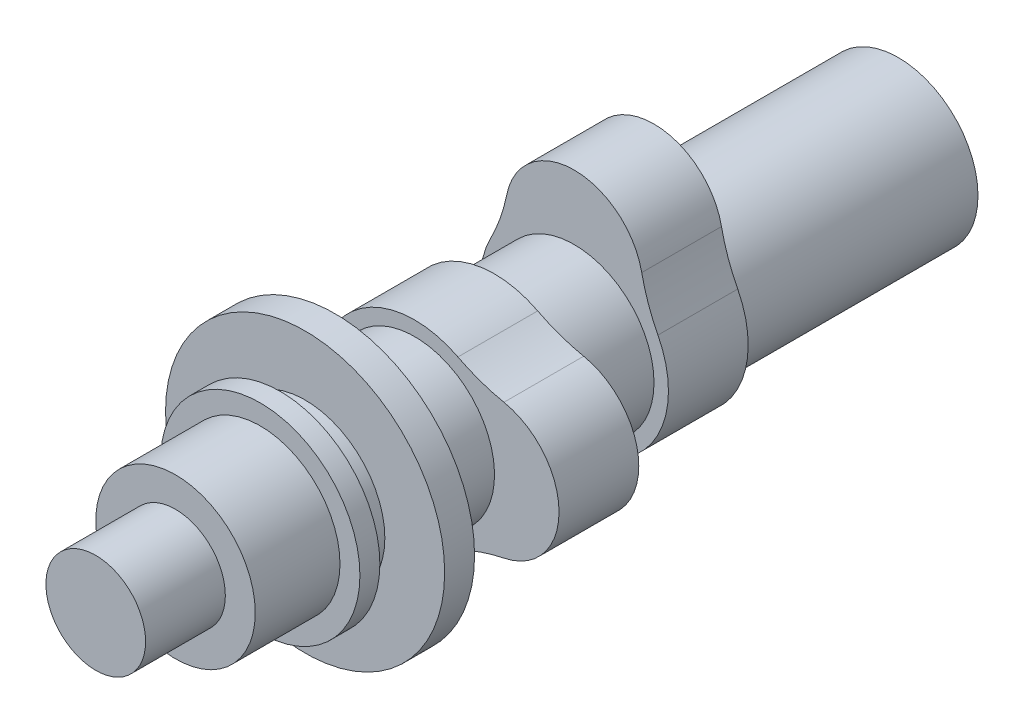
from build123d import *

# Parameters (mm, degrees)
BOSS_EXTRUDE2_DEPTH      = 12.7
BOSS_EXTRUDE3_DEPTH      = 63.5
BOSS_EXTRUDE3_DEPTH_BACK = 51.59375
SKETCH3_R                = 12.7
CRVPATTERN3_START        = 25.4
CRVPATTERN3_OUTLINE_R    = 12.7
CRVPATTERN3_DEPTH        = 12.7
BOSS_EXTRUDE5_START      = -25.4
SKETCH7_R                = 22.225
BOSS_EXTRUDE5_DEPTH      = 4.7625
BOSS_EXTRUDE7_START      = -13.49375
SKETCH10_R               = 15.875
BOSS_EXTRUDE7_DEPTH      = 3.175
SKETCH9_R                = 7.9375
BOSS_EXTRUDE8_DEPTH      = 12.7


# Read off the part's stored shape, not the designer's step: CrvPattern3
with BuildPart() as part:
    # Sketch2 → Boss-Extrude2 (new body)
    with BuildSketch(Plane.XY):
        with BuildLine():
            ThreePointArc((-10.74656161, 14.203426928), (-11.786721082, 10.450325862), (-13.330377698, 6.874738694))
            ThreePointArc((-13.330377698, 6.874738694), (0, -14.9987), (13.330377698, 6.874738694))
            ThreePointArc((13.330377698, 6.874738694), (11.786721082, 10.450325862), (10.74656161, 14.203426928))
            ThreePointArc((10.74656161, 14.203426928), (0, 22.9743), (-10.74656161, 14.203426928))
        make_face()
    extrude(amount=BOSS_EXTRUDE2_DEPTH)

    # Sketch3 → Boss-Extrude3 (add, two sides: drawn at the far end of the back side and taken through both)
    with BuildSketch(Plane.XY.offset(12.7).offset(-BOSS_EXTRUDE3_DEPTH_BACK)):
        Circle(SKETCH3_R)
    extrude(amount=BOSS_EXTRUDE3_DEPTH + BOSS_EXTRUDE3_DEPTH_BACK)

    # CrvPattern3 outline → CrvPattern3 (add)
    with BuildSketch(Plane.XY.offset(CRVPATTERN3_START)):
        with BuildLine():
            ThreePointArc((6.874738694, 13.330377698), (-14.9987, 0), (6.874738694, -13.330377698))
            ThreePointArc((6.874738694, -13.330377698), (10.450325862, -11.786721082), (14.203426928, -10.74656161))
            ThreePointArc((14.203426928, -10.74656161), (22.9743, 0), (14.203426928, 10.74656161))
            ThreePointArc((14.203426928, 10.74656161), (10.450325862, 11.786721082), (6.874738694, 13.330377698))
        make_face()
        Circle(CRVPATTERN3_OUTLINE_R, mode=Mode.SUBTRACT)
    extrude(amount=CRVPATTERN3_DEPTH)

    # Sketch7 → Boss-Extrude5 (add)
    with BuildSketch(Plane.XY.offset(76.2).offset(BOSS_EXTRUDE5_START)):
        with Locations(Location((0, 0, 0), (0, 0, 180))):
            Circle(SKETCH7_R)
    extrude(amount=BOSS_EXTRUDE5_DEPTH)

    # Sketch10 → Boss-Extrude7 (add)
    with BuildSketch(Plane.XY.offset(76.2).offset(BOSS_EXTRUDE7_START)):
        Circle(SKETCH10_R)
    extrude(amount=-BOSS_EXTRUDE7_DEPTH)

    # Sketch9 → Boss-Extrude8 (add)
    with BuildSketch(Plane.XY.offset(76.2)):
        Circle(SKETCH9_R)
    extrude(amount=BOSS_EXTRUDE8_DEPTH)


solid = part.part
